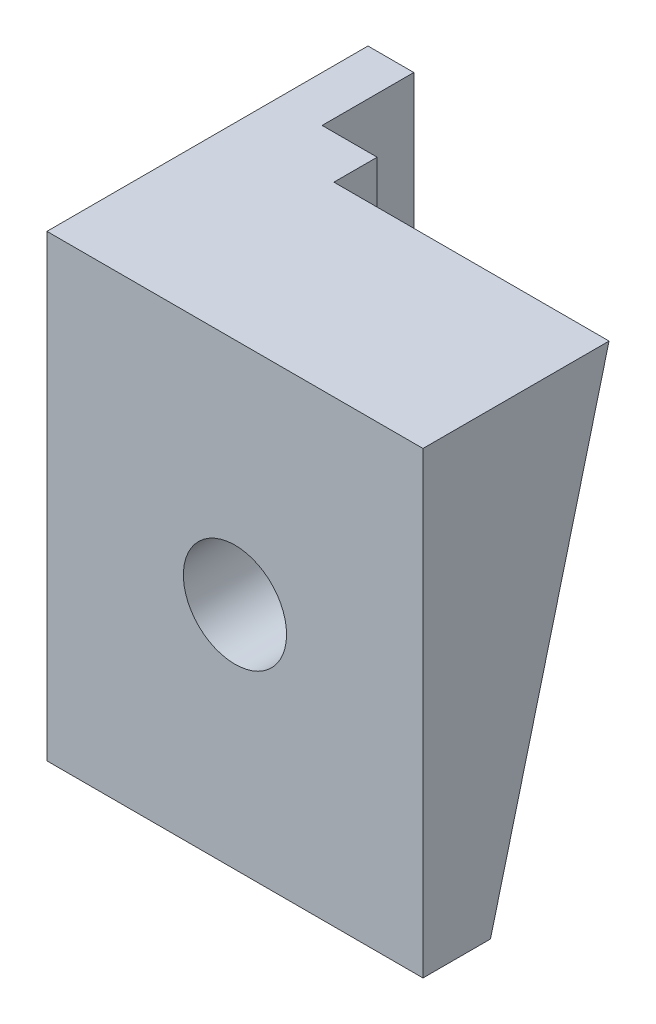
from build123d import *

# Parameters (mm, degrees)
SKETCH2_W           = 2.2
SKETCH2_H           = 10
BOSS_EXTRUDE1_DEPTH = 5
SKETCH2_3_W         = 1
SKETCH2_3_H         = 10
BOSS_EXTRUDE2_DEPTH = 2
BOSS_EXTRUDE3_DEPTH = 6
SKETCH4_R           = 1.125
CUT_EXTRUDE1_DEPTH  = 6


with BuildPart() as part:
    # Sketch2 → Boss-Extrude1 (new body)
    with BuildSketch(Plane.XY):
        with Locations((1.1, 5)):
            Rectangle(SKETCH2_W, SKETCH2_H)
    extrude(amount=BOSS_EXTRUDE1_DEPTH)

    # Sketch2<3> → Boss-Extrude2 (add)
    with BuildSketch(Plane.XY):
        with Locations((0.5, 5)):
            Rectangle(SKETCH2_3_W, SKETCH2_3_H)
    extrude(amount=-BOSS_EXTRUDE2_DEPTH)

    # Sketch3 → Boss-Extrude3 (add)
    with BuildSketch(Plane(origin=(2.2, 0, 0), x_dir=(0, 0, -1), z_dir=(1, 0, 0))):
        Polygon((-5, 0), (-3.52903009, 0), (-0.942854246, 10), (-5, 10), align=None)
    extrude(amount=BOSS_EXTRUDE3_DEPTH)

    # Sketch4 → Cut-Extrude1 (cut)
    with BuildSketch(Plane.XY.offset(5)):
        with Locations((4.1, 5)):
            Circle(SKETCH4_R)
    extrude(amount=-CUT_EXTRUDE1_DEPTH, mode=Mode.SUBTRACT)


solid = part.part
